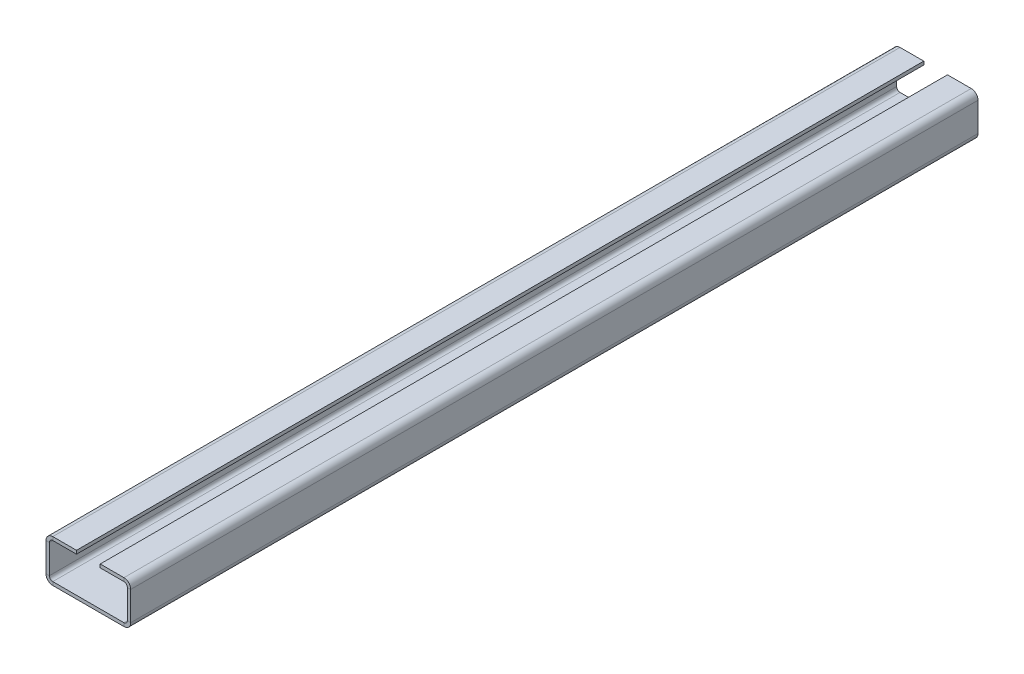
from build123d import *

# Parameters (mm, degrees)
BASE_FLANGE1_DEPTH = 500


# Sheet-metal steps are written as plain solids
with BuildPart() as part:
    # Sketch1 → Base-Flange1 (new body)
    with BuildSketch(Plane.XY):
        with BuildLine():
            Line((18, 25), (4, 25))
            ThreePointArc((4, 25), (1.171572875, 23.828427125), (0, 21))
            Line((0, 21), (0, 4))
            ThreePointArc((0, 4), (1.171572875, 1.171572875), (4, 0))
            Line((4, 0), (46, 0))
            ThreePointArc((46, 0), (48.828427125, 1.171572875), (50, 4))
            Line((50, 4), (50, 21))
            ThreePointArc((50, 21), (48.828427125, 23.828427125), (46, 25))
            Line((46, 25), (32, 25))
            Line((32, 25), (32, 23))
            Line((32, 23), (46, 23))
            ThreePointArc((46, 23), (47.414213562, 22.414213562), (48, 21))
            Line((48, 21), (48, 4))
            ThreePointArc((48, 4), (47.414213562, 2.585786438), (46, 2))
            Line((46, 2), (4, 2))
            ThreePointArc((4, 2), (2.585786438, 2.585786438), (2, 4))
            Line((2, 4), (2, 21))
            ThreePointArc((2, 21), (2.585786438, 22.414213562), (4, 23))
            Line((4, 23), (18, 23))
            Line((18, 23), (18, 25))
        make_face()
    extrude(amount=BASE_FLANGE1_DEPTH)


solid = part.part
